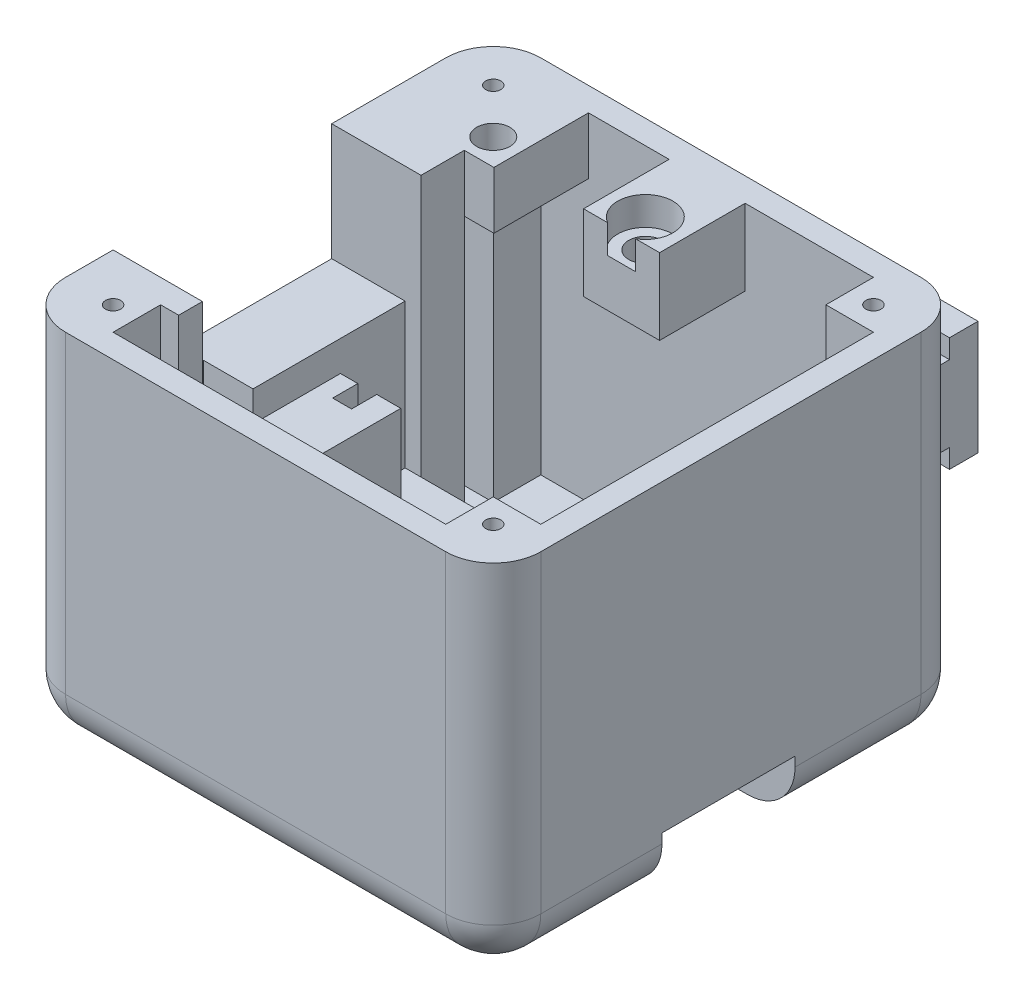
from build123d import *

# Parameters (mm, degrees)
SKETCH1_W                = 50
SKETCH1_H                = 50
BOSS_EXTRUDE1_DEPTH      = 38
SHELL1_T                 = -2.5
BOSS_EXTRUDE2_DEPTH      = 15
SKETCH3_W                = 45
SKETCH3_H                = 16
BOSS_EXTRUDE3_DEPTH      = 8
SKETCH4_W                = 32.5
SKETCH4_H                = 8.5
CUT_EXTRUDE1_DEPTH       = 2.6
SKETCH7_W                = 32.5
SKETCH7_H                = 12.5
CUT_EXTRUDE2_DEPTH       = 3.2
SKETCH9_W                = 8.5
SKETCH9_H                = 32.5
CUT_EXTRUDE3_DEPTH       = 3
CUT_EXTRUDE5_DEPTH       = 3
FILLET1_R                = 5
SKETCH16_R               = 1.9
CUT_EXTRUDE8_DEPTH       = 53.768953941
SKETCH17_W               = 23
SKETCH17_H               = 12
BOSS_EXTRUDE5_DEPTH      = 6
SKETCH18_W               = 3
SKETCH18_H               = 2
CUT_EXTRUDE9_DEPTH       = 57.471231614
CUT_EXTRUDE13_DEPTH      = 2
CUT_EXTRUDE14_DEPTH      = 19
CUT_EXTRUDE10_START      = -19.5
CUT_EXTRUDE10_DEPTH      = 19.5
CUT_EXTRUDE35_START      = -19.5
CUT_EXTRUDE35_DEPTH      = 19.5
FILLET4_R                = 2
CUT_EXTRUDE18_DEPTH      = 13
CUT_EXTRUDE18_DEPTH_BACK = 1
SKETCH26_W               = 6
SKETCH26_H               = 6
SKETCH30_W               = 4.8
SKETCH30_H               = 2.3
CUT_EXTRUDE19_DEPTH      = 59.832389039
SKETCH34_W               = 2
SKETCH34_H               = 3.1
CUT_EXTRUDE23_DEPTH      = 7.3
CUT_EXTRUDE25_START      = -3
CUT_EXTRUDE25_DEPTH      = 3
FILLET8_R                = 2
SKETCH56_W               = 5
SKETCH56_H               = 5
BOSS_EXTRUDE10_DEPTH     = 35.5
CIRPATTERN1_COUNT        = 4
SKETCH62_W               = 6.9
SKETCH62_H               = 2.75
BOSS_EXTRUDE11_DEPTH     = 35.5
SKETCH63_W               = 6.9
SKETCH63_H               = 4.55
BOSS_EXTRUDE12_DEPTH     = 35.5
CUT_EXTRUDE37_REACH      = 72.036
SKETCH64_W               = 23
SKETCH64_H               = 12.3
SKETCH65_W               = 5.223922691
SKETCH65_H               = 16
BOSS_EXTRUDE13_DEPTH     = 15.2
BOSS_EXTRUDE14_DEPTH     = 20
BOSS_EXTRUDE18_REACH     = 59.546
SKETCH68_W               = 2.5
SKETCH68_H               = 26.3
SKETCH69_W               = 6.346077309
SKETCH69_H               = 9.2
BOSS_EXTRUDE20_DEPTH     = 12
SKETCH70_W               = 4.69696766
SKETCH70_H               = 9.2
BOSS_EXTRUDE21_DEPTH     = 12
SKETCH72_W               = 8
SKETCH72_H               = 8
BOSS_EXTRUDE22_DEPTH     = 9
BOSS_EXTRUDE23_DEPTH     = 6
SKETCH76_R               = 1.75
CUT_EXTRUDE43_DEPTH      = 6
SKETCH81_W               = 2
SKETCH81_H               = 3
CUT_EXTRUDE44_DEPTH      = 10
SKETCH82_W               = 3
SKETCH82_H               = 8.5
BOSS_EXTRUDE24_DEPTH     = 0.2
SKETCH83_W               = 8.5
SKETCH83_H               = 4.3
BOSS_EXTRUDE25_DEPTH     = 0.5
SKETCH45_R               = 3.75
CUT_EXTRUDE27_DEPTH      = 20
SKETCH84_W               = 22.5
SKETCH84_H               = 9.2
BOSS_EXTRUDE26_DEPTH     = 2.8
SKETCH85_R               = 1.75
CUT_EXTRUDE45_DEPTH      = 8
SKETCH86_R               = 2.9
CUT_EXTRUDE47_DEPTH      = 3
SKETCH88_W               = 1.990680165
SKETCH88_H               = 3
CUT_EXTRUDE48_DEPTH      = 12
SKETCH89_W               = 17.5
SKETCH89_H               = 2.5
CUT_EXTRUDE50_DEPTH      = 1.45
SKETCH91_W               = 1.234611636
SKETCH91_H               = 9.75
CUT_EXTRUDE52_DEPTH      = 2
CUT_EXTRUDE53_DEPTH      = 1
CUT_EXTRUDE54_DEPTH      = 2
SKETCH94_W               = 2.73303234
SKETCH94_H               = 4.25
CUT_EXTRUDE55_DEPTH      = 4.5
SKETCH95_W               = 5.73303234
SKETCH95_H               = 4.5
CUT_EXTRUDE56_DEPTH      = 0.25


with BuildPart() as part:
    # Sketch1 → Boss-Extrude1 (new body)
    with BuildSketch(Plane(origin=(0, 0, 0), x_dir=(1, 0, 0), z_dir=(0, 1, 0))):
        Rectangle(SKETCH1_W, SKETCH1_H)
    extrude(amount=BOSS_EXTRUDE1_DEPTH)

    # Shell1
    shell1_openings = [part.faces().sort_by_distance(p)[0] for p in [
        (0, 38, 0),
    ]]
    offset(amount=SHELL1_T, openings=shell1_openings, kind=Kind.INTERSECTION)

    # Sketch2 → Boss-Extrude2 (add)
    with BuildSketch(Plane(origin=(0, 2.5, 0), x_dir=(1, 0, 0), z_dir=(0, 1, 0))):
        Polygon((10.3, 8), (22.5, 8), (22.5, 22.5), (10.3, 22.5), (10.3, 13.5), align=None)
    extrude(amount=BOSS_EXTRUDE2_DEPTH)

    # Sketch3 → Boss-Extrude3 (add)
    with BuildSketch(Plane(origin=(0, 2.5, 0), x_dir=(1, 0, 0), z_dir=(0, 1, 0))):
        Rectangle(SKETCH3_W, SKETCH3_H)
    extrude(amount=BOSS_EXTRUDE3_DEPTH)

    # Sketch4 → Cut-Extrude1 (cut)
    with BuildSketch(Plane.XZ):
        with Locations((8.75, 0)):
            Rectangle(SKETCH4_W, SKETCH4_H)
    extrude(amount=-CUT_EXTRUDE1_DEPTH, mode=Mode.SUBTRACT)

    # Sketch7 → Cut-Extrude2 (cut)
    with BuildSketch(Plane(origin=(0, 2.6, 0), x_dir=(-1, 0, 0), z_dir=(0, -1, 0))):
        with Locations((-8.75, 0)):
            Rectangle(SKETCH7_W, SKETCH7_H)
    extrude(amount=-CUT_EXTRUDE2_DEPTH, mode=Mode.SUBTRACT)

    # Sketch9 → Cut-Extrude3 (cut)
    with BuildSketch(Plane(origin=(25, 0, 0), x_dir=(0, 0, -1), z_dir=(1, 0, 0))):
        with Locations((0, 16.25)):
            Rectangle(SKETCH9_W, SKETCH9_H)
    extrude(amount=-CUT_EXTRUDE3_DEPTH, mode=Mode.SUBTRACT)

    # Sketch10 → Cut-Extrude5 (cut)
    with BuildSketch(Plane(origin=(22, 0, 0), x_dir=(0, 0, -1), z_dir=(1, 0, 0))):
        Polygon((-6, 32.5), (-6, 0), (6.25, 0), (6.25, 2.6), (6.25, 32.5), align=None)
    extrude(amount=-CUT_EXTRUDE5_DEPTH, mode=Mode.SUBTRACT)

    # Fillet1
    # the kernel refuses this fillet: 5 mm, written as the material it takes off along each edge
    with BuildSketch(Plane(origin=(-20, 5, 20), x_dir=(-1, 0, 0), z_dir=(0, 0, 1))) as fillet1_piece_1_section:
        Polygon((0, 0), (FILLET1_R, 0), (FILLET1_R, FILLET1_R), (0, FILLET1_R), align=None)
    fillet1_piece_1 = extrude(amount=FILLET1_R, mode=Mode.PRIVATE)
    fillet1_piece_1 = fillet1_piece_1 - Plane(origin=(-20, 5, 20), x_dir=(0.7071067811865475, 0.7071067811865475, 0), z_dir=(0, 0, 1)) * Sphere(FILLET1_R, mode=Mode.PRIVATE)
    add(fillet1_piece_1, mode=Mode.SUBTRACT)
    with BuildSketch(Plane(origin=(20, 5, 20), x_dir=(1, 0, 0), z_dir=(0, 0, 1))) as fillet1_piece_2_section:
        Polygon((0, 0), (FILLET1_R, 0), (FILLET1_R, -FILLET1_R), (0, -FILLET1_R), align=None)
    fillet1_piece_2 = extrude(amount=FILLET1_R, mode=Mode.PRIVATE)
    fillet1_piece_2 = fillet1_piece_2 - Plane(origin=(20, 5, 20), x_dir=(-0.7071067811865475, 0.7071067811865475, 0), z_dir=(0, 0, 1)) * Sphere(FILLET1_R, mode=Mode.PRIVATE)
    add(fillet1_piece_2, mode=Mode.SUBTRACT)
    with BuildSketch(Plane(origin=(20, 5, -20), x_dir=(1, 0, 0), z_dir=(0, 0, -1))) as fillet1_piece_3_section:
        Polygon((0, 0), (FILLET1_R, 0), (FILLET1_R, FILLET1_R), (0, FILLET1_R), align=None)
    fillet1_piece_3 = extrude(amount=FILLET1_R, mode=Mode.PRIVATE)
    fillet1_piece_3 = fillet1_piece_3 - Plane(origin=(20, 5, -20), x_dir=(-0.7071067811865475, 0.7071067811865475, 0), z_dir=(0, 0, -1)) * Sphere(FILLET1_R, mode=Mode.PRIVATE)
    add(fillet1_piece_3, mode=Mode.SUBTRACT)
    with BuildSketch(Plane(origin=(-20, 5, -20), x_dir=(-1, 0, 0), z_dir=(0, 0, -1))) as fillet1_piece_4_section:
        Polygon((0, 0), (FILLET1_R, 0), (FILLET1_R, -FILLET1_R), (0, -FILLET1_R), align=None)
    fillet1_piece_4 = extrude(amount=FILLET1_R, mode=Mode.PRIVATE)
    fillet1_piece_4 = fillet1_piece_4 - Plane(origin=(-20, 5, -20), x_dir=(0.7071067811865475, 0.7071067811865475, 0), z_dir=(0, 0, -1)) * Sphere(FILLET1_R, mode=Mode.PRIVATE)
    add(fillet1_piece_4, mode=Mode.SUBTRACT)
    with BuildSketch(Plane(origin=(-25, 5, 25), x_dir=(0, 0, -1), z_dir=(0, 1, 0)), Plane(origin=(-25, 5, -25), x_dir=(1, 0, 0), z_dir=(0, 1, 0))) as fillet1_piece_5:
        with BuildLine():
            CenterArc((FILLET1_R, -FILLET1_R), FILLET1_R, 90, 90)
            Line((0, -FILLET1_R), (0, 0))
            Line((0, 0), (FILLET1_R, 0))
        make_face()
    extrude(amount=45.5, mode=Mode.SUBTRACT)
    with BuildSketch(Plane(origin=(25, 5, 25), x_dir=(0, 0, -1), z_dir=(0, 1, 0)), Plane(origin=(25, 5, -25), x_dir=(-1, 0, 0), z_dir=(0, 1, 0))) as fillet1_piece_6:
        with BuildLine():
            CenterArc((FILLET1_R, FILLET1_R), FILLET1_R, 180, 90)
            Line((0, FILLET1_R), (0, 0))
            Line((0, 0), (FILLET1_R, 0))
        make_face()
    extrude(amount=45.5, mode=Mode.SUBTRACT)
    with BuildSketch(Plane(origin=(-25, 0, -20), x_dir=(0, 1, 0), z_dir=(0, 0, 1)), Plane(origin=(20, 0, -25), x_dir=(0, 1, 0), z_dir=(-1, 0, 0))) as fillet1_piece_7:
        with BuildLine():
            CenterArc((FILLET1_R, -FILLET1_R), FILLET1_R, 90, 90)
            Line((0, -FILLET1_R), (0, 0))
            Line((0, 0), (FILLET1_R, 0))
        make_face()
    extrude(amount=40, mode=Mode.SUBTRACT)
    with BuildSketch(Plane(origin=(-20, 0, 25), x_dir=(0, 0, -1), z_dir=(1, 0, 0))) as fillet1_piece_8:
        with BuildLine():
            CenterArc((FILLET1_R, FILLET1_R), FILLET1_R, 180, 90)
            Line((0, FILLET1_R), (0, 0))
            Line((0, 0), (FILLET1_R, 0))
        make_face()
    extrude(amount=40, mode=Mode.SUBTRACT)
    with BuildSketch(Plane(origin=(25, 0, 20), x_dir=(0, 1, 0), z_dir=(0, 0, -1)), Plane(origin=(25, 0, 8.25), x_dir=(0, 1, 0), z_dir=(0, 0, -1))) as fillet1_piece_9:
        with BuildLine():
            CenterArc((FILLET1_R, -FILLET1_R), FILLET1_R, 90, 90)
            Line((0, -FILLET1_R), (0, 0))
            Line((0, 0), (FILLET1_R, 0))
        make_face()
    extrude(amount=28.25, mode=Mode.SUBTRACT)

    # Sketch16 → Cut-Extrude8 (cut, through all)
    with BuildSketch(Plane(origin=(0, 0, 1.75), x_dir=(-1, 0, 0), z_dir=(0, 0, -1))):
        with Locations(Location((-15.3, 9.7, 0), (0, 0, 155.09893763))):
            Circle(SKETCH16_R)
    extrude(amount=CUT_EXTRUDE8_DEPTH, mode=Mode.SUBTRACT)

    # Sketch17 → Boss-Extrude5 (add)
    with BuildSketch(Plane(origin=(0, 0, -25), x_dir=(-1, 0, 0), z_dir=(0, 0, -1))):
        with Locations((-8.5, 25)):
            Rectangle(SKETCH17_W, SKETCH17_H)
    extrude(amount=BOSS_EXTRUDE5_DEPTH)

    # Sketch18 → Cut-Extrude9 (cut, through all)
    with BuildSketch(Plane.ZY.offset(3)):
        with Locations((-26.5, 20)):
            Rectangle(SKETCH18_W, SKETCH18_H)
        with Locations((-26.5, 30)):
            Rectangle(SKETCH18_W, SKETCH18_H)
    extrude(amount=-CUT_EXTRUDE9_DEPTH, mode=Mode.SUBTRACT)

    # Sketch21 → Cut-Extrude13 (cut)
    with BuildSketch(Plane(origin=(0, 0, 4.25), x_dir=(-1, 0, 0), z_dir=(0, 0, -1))):
        with BuildLine():
            Line((-15.746666667, 2.6), (-19, 2.6))
            Line((-19, 2.6), (-19, 0))
            Line((-19, 0), (-18, 0))
            ThreePointArc((-18, 0), (-17.358276657, 1.720284214), (-15.746666667, 2.6))
        make_face()
    extrude(amount=-CUT_EXTRUDE13_DEPTH, mode=Mode.SUBTRACT)

    # Sketch22 → Cut-Extrude14 (cut)
    with BuildSketch(Plane(origin=(0, 0, 4.25), x_dir=(-1, 0, 0), z_dir=(0, 0, -1))):
        with BuildLine():
            Line((-15.3, 9.7), (-14.171286845, 3.298749605))
            ThreePointArc((-14.171286845, 3.298749605), (-19.896194078, 5.103805922), (-21.701250395, 10.828713155))
            Line((-21.701250395, 10.828713155), (-15.3, 9.7))
        make_face()
    extrude(amount=CUT_EXTRUDE14_DEPTH, mode=Mode.SUBTRACT)

    # Sketch19 → Cut-Extrude10 (cut)
    with BuildSketch(Plane(origin=(0, 0, -25), x_dir=(-1, 0, 0), z_dir=(0, 0, -1)).offset(CUT_EXTRUDE10_START)):
        with BuildLine():
            ThreePointArc((-16.15049081, 8.000981053), (-16.643502884, 8.356497116), (-16.999018947, 8.84950919))
            Line((-16.999018947, 8.84950919), (-17.600059711, 8.248468426))
            Line((-17.600059711, 8.248468426), (-16.751531574, 7.399940289))
            Line((-16.751531574, 7.399940289), (-16.15049081, 8.000981053))
        make_face()
        with BuildLine():
            ThreePointArc((-14.44950919, 11.399018947), (-13.956497116, 11.043502884), (-13.600981053, 10.55049081))
            Line((-13.600981053, 10.55049081), (-12.999940289, 11.151531574))
            Line((-12.999940289, 11.151531574), (-13.848468426, 12.000059711))
            Line((-13.848468426, 12.000059711), (-14.44950919, 11.399018947))
        make_face()
    extrude(amount=CUT_EXTRUDE10_DEPTH, mode=Mode.SUBTRACT)

    # Sketch55 → Cut-Extrude35 (cut)
    with BuildSketch(Plane(origin=(0, 0, -25), x_dir=(-1, 0, 0), z_dir=(0, 0, -1)).offset(CUT_EXTRUDE35_START)):
        with BuildLine():
            Line((-16.999018947, 8.84950919), (-17.600059711, 8.248468426))
            Line((-17.600059711, 8.248468426), (-16.751531574, 7.399940289))
            Line((-16.751531574, 7.399940289), (-16.15049081, 8.000981053))
            ThreePointArc((-16.15049081, 8.000981053), (-16.643502884, 8.356497116), (-16.999018947, 8.84950919))
        make_face()
        with BuildLine():
            Line((-14.44950919, 11.399018947), (-13.848468426, 12.000059711))
            Line((-13.848468426, 12.000059711), (-12.999940289, 11.151531574))
            Line((-12.999940289, 11.151531574), (-13.576631206, 10.5))
            ThreePointArc((-13.576631206, 10.5), (-13.936824633, 11.023538031), (-14.44950919, 11.399018947))
        make_face()
    extrude(amount=CUT_EXTRUDE35_DEPTH, mode=Mode.SUBTRACT)

    # Fillet4
    fillet4_edges = [part.edges().sort_by_distance(p)[0] for p in [
        (-3, 31, -29.5),
        (-3, 19, -29.5),
        (-3, 25, -31),
    ]]
    fillet(fillet4_edges, radius=FILLET4_R)

    # Sketch26 → Cut-Extrude18 (cut, two sides: drawn at the far end of the back side and taken through both)
    with BuildSketch(Plane(origin=(0, 0, 6.25), x_dir=(-1, 0, 0), z_dir=(0, 0, -1)).offset(-CUT_EXTRUDE18_DEPTH_BACK)):
        with Locations((-22, 3)):
            Rectangle(SKETCH26_W, SKETCH26_H)
    extrude(amount=CUT_EXTRUDE18_DEPTH + CUT_EXTRUDE18_DEPTH_BACK, mode=Mode.SUBTRACT)

    # Sketch30 → Cut-Extrude19 (cut, through all)
    with BuildSketch(Plane(origin=(-7.5, 0, 0), x_dir=(0, 0, -1), z_dir=(1, 0, 0))):
        with Locations((0, 2.6)):
            Rectangle(SKETCH30_W, SKETCH30_H)
    extrude(amount=-CUT_EXTRUDE19_DEPTH, mode=Mode.SUBTRACT)

    # Sketch34 → Cut-Extrude23 (cut)
    with BuildSketch(Plane(origin=(0, 10.5, 0), x_dir=(1, 0, 0), z_dir=(0, 1, 0))):
        with Locations((-14.45, 0)):
            Rectangle(SKETCH34_W, SKETCH34_H)
    extrude(amount=-CUT_EXTRUDE23_DEPTH, mode=Mode.SUBTRACT)

    # Sketch43 → Cut-Extrude25 (cut)
    with BuildSketch(Plane.XY.offset(-4.25).offset(CUT_EXTRUDE25_START)):
        with BuildLine():
            Line((18, 0), (19, 0))
            Line((19, 0), (19, 2.6))
            Line((19, 2.6), (15.746666667, 2.6))
            ThreePointArc((15.746666667, 2.6), (17.358276657, 1.720284214), (18, 0))
        make_face()
    extrude(amount=CUT_EXTRUDE25_DEPTH, mode=Mode.SUBTRACT)

    # Fillet8
    # the kernel refuses this fillet: 2 mm, written as the material it takes off along each edge
    with BuildSketch(Plane(origin=(19, -4.330127019, 6.25), x_dir=(0, 0, 1), z_dir=(0, 1, 0))) as fillet8_piece_1_section:
        with BuildLine():
            CenterArc((2, -1.732050808), FILLET8_R, 120, 60)
            Line((0, -1.732050808), (0, 0))
            Line((0, 0), (1, 0))
        make_face()
    fillet8_piece_1 = extrude(amount=10.130127019, mode=Mode.PRIVATE)
    fillet8_piece_1 = fillet8_piece_1 - Plane(origin=(15.373333333, 0, 6.514485091), x_dir=(1, 0, 0), z_dir=(0, 0, -1)) * Cylinder(2.626666667, 28, mode=Mode.PRIVATE)
    add(fillet8_piece_1, mode=Mode.SUBTRACT)

    # Sketch56 → Boss-Extrude10 (add)
    with BuildSketch(Plane(origin=(0, 2.5, 0), x_dir=(1, 0, 0), z_dir=(0, 1, 0))):
        with Locations((-20, -20)):
            Rectangle(SKETCH56_W, SKETCH56_H)
    boss_extrude10 = extrude(amount=BOSS_EXTRUDE10_DEPTH)

    # Sketch59 → M2 Tapped Hole3 (revolve, cut)
    with BuildSketch(Plane(origin=(-20, 38, 20), x_dir=(0, 0, 1), z_dir=(1, 0, 0))):
        Polygon((0, 0), (0, 5.480688495), (0.8, 5), (0.8, 0), align=None)
    m2_tapped_hole3 = revolve(axis=Axis((-20, 44.35, 20), (0, -1, 0)), mode=Mode.SUBTRACT)

    # CirPattern1: Boss-Extrude10, M2 Tapped Hole3 ×4 about axis
    cirpattern1_axis = Axis((0, 0, 0), (0, 1, 0))
    add([boss_extrude10.rotate(cirpattern1_axis, i * 360 / CIRPATTERN1_COUNT) for i in range(1, CIRPATTERN1_COUNT)])
    add([m2_tapped_hole3.rotate(cirpattern1_axis, i * 360 / CIRPATTERN1_COUNT) for i in range(1, CIRPATTERN1_COUNT)], mode=Mode.SUBTRACT)

    # Sketch62 → Boss-Extrude11 (add)
    with BuildSketch(Plane(origin=(0, 2.5, 0), x_dir=(1, 0, 0), z_dir=(0, 1, 0))):
        with Locations((-19.05, -16.125)):
            Rectangle(SKETCH62_W, SKETCH62_H)
    extrude(amount=BOSS_EXTRUDE11_DEPTH)

    # Sketch63 → Boss-Extrude12 (add)
    with BuildSketch(Plane(origin=(0, 2.5, 0), x_dir=(1, 0, 0), z_dir=(0, 1, 0))):
        with Locations((-19.05, 10.275)):
            Rectangle(SKETCH63_W, SKETCH63_H)
    extrude(amount=BOSS_EXTRUDE12_DEPTH)

    # Sketch64 → Cut-Extrude37 (cut, up to next)
    with BuildSketch(Plane.ZY.offset(25), mode=Mode.PRIVATE) as cut_extrude37_sk1:
        with Locations((3.5, 31.85)):
            Rectangle(SKETCH64_W, SKETCH64_H)
    cut_extrude37_tool1 = extrude(cut_extrude37_sk1.sketch, amount=-CUT_EXTRUDE37_REACH, mode=Mode.PRIVATE) & part.part
    add(cut_extrude37_tool1.solids().sort_by_distance((-25, 31.85, 3.5))[0], mode=Mode.SUBTRACT)

    # Sketch65 → Boss-Extrude13 (add)
    with BuildSketch(Plane(origin=(0, 10.5, 0), x_dir=(1, 0, 0), z_dir=(0, 1, 0))):
        with Locations((-19.888038655, 0)):
            Rectangle(SKETCH65_W, SKETCH65_H)
    extrude(amount=BOSS_EXTRUDE13_DEPTH)

    # Sketch66 → Boss-Extrude14 (add)
    with BuildSketch(Plane(origin=(0, 2.5, 0), x_dir=(1, 0, 0), z_dir=(0, 1, 0))):
        Polygon((-10.93, -8), (-12.93, -8), (-12.93, -16.5), (13.57, -16.5), (13.57, -8), (11.57, -8), (11.57, -14.5), (-10.93, -14.5), align=None)
    extrude(amount=BOSS_EXTRUDE14_DEPTH)

    # Sketch68 → Boss-Extrude18 (add, up to next)
    with BuildSketch(Plane(origin=(0, 0, 4.25), x_dir=(-1, 0, 0), z_dir=(0, 0, -1)), mode=Mode.PRIVATE) as boss_extrude18_sk1:
        with Locations((-23.75, 19.35)):
            Rectangle(SKETCH68_W, SKETCH68_H)
    boss_extrude18_tool1 = extrude(boss_extrude18_sk1.sketch, amount=BOSS_EXTRUDE18_REACH, mode=Mode.PRIVATE) - part.part
    add(boss_extrude18_tool1.solids().sort_by_distance((23.75, 19.35, 4.25))[0])

    # Sketch69 → Boss-Extrude20 (add)
    with BuildSketch(Plane(origin=(0, 10.5, 0), x_dir=(1, 0, 0), z_dir=(0, 1, 0))):
        with Locations((-14.103038655, -3.4)):
            Rectangle(SKETCH69_W, SKETCH69_H)
    extrude(amount=BOSS_EXTRUDE20_DEPTH)

    # Sketch70 → Boss-Extrude21 (add)
    with BuildSketch(Plane(origin=(0, 10.5, 0), x_dir=(1, 0, 0), z_dir=(0, 1, 0))):
        with Locations((13.91848383, -3.4)):
            Rectangle(SKETCH70_W, SKETCH70_H)
    extrude(amount=BOSS_EXTRUDE21_DEPTH)

    # Sketch72 → Boss-Extrude22 (add)
    with BuildSketch(Plane.XY.offset(-22.5)):
        with Locations((0, 34)):
            Rectangle(SKETCH72_W, SKETCH72_H)
    extrude(amount=BOSS_EXTRUDE22_DEPTH)

    # Sketch75 → Boss-Extrude23 (add)
    with BuildSketch(Plane(origin=(0, 38, 0), x_dir=(1, 0, 0), z_dir=(0, 1, 0))):
        Polygon((-15.6, 12.55), (-12.482059463, 12.55), (-12.482059463, 22.5), (-17.5, 22.5), (-17.5, 17.5), (-22.5, 17.5), (-22.5, 12.55), align=None)
    extrude(amount=-BOSS_EXTRUDE23_DEPTH)

    # Sketch76 → Cut-Extrude43 (cut)
    with BuildSketch(Plane(origin=(0, 38, 0), x_dir=(1, 0, 0), z_dir=(0, 1, 0))):
        with Locations(Location((-15.3, 15.3, 0), (0, 0, 270))):
            Circle(SKETCH76_R)
    extrude(amount=-CUT_EXTRUDE43_DEPTH, mode=Mode.SUBTRACT)

    # Sketch81 → Cut-Extrude44 (cut)
    with BuildSketch(Plane(origin=(0, 22.5, 0), x_dir=(1, 0, 0), z_dir=(0, 1, 0))):
        with Locations((-11.93, -9.5)):
            Rectangle(SKETCH81_W, SKETCH81_H)
    extrude(amount=-CUT_EXTRUDE44_DEPTH, mode=Mode.SUBTRACT)

    # Sketch82 → Boss-Extrude24 (add)
    with BuildSketch(Plane.XZ.offset(-6.2)):
        with Locations((23.5, 0)):
            Rectangle(SKETCH82_W, SKETCH82_H)
    extrude(amount=BOSS_EXTRUDE24_DEPTH)

    # Sketch83 → Boss-Extrude25 (add)
    with BuildSketch(Plane.ZY.offset(-22.5)):
        with Locations((0, 8.35)):
            Rectangle(SKETCH83_W, SKETCH83_H)
    extrude(amount=BOSS_EXTRUDE25_DEPTH)

    # Sketch45 → Cut-Extrude27 (cut)
    with BuildSketch(Plane(origin=(0, 0, 1.75), x_dir=(-1, 0, 0), z_dir=(0, 0, -1))):
        with Locations(Location((-15.3, 9.7, 0), (0, 0, 170))):
            Circle(SKETCH45_R)
    extrude(amount=CUT_EXTRUDE27_DEPTH, mode=Mode.SUBTRACT)

    # Sketch84 → Boss-Extrude26 (add)
    with BuildSketch(Plane(origin=(0, 10.5, 0), x_dir=(1, 0, 0), z_dir=(0, 1, 0))):
        with Locations((0.32, -3.4)):
            Rectangle(SKETCH84_W, SKETCH84_H)
    extrude(amount=BOSS_EXTRUDE26_DEPTH)

    # Sketch85 → Cut-Extrude45 (cut)
    with BuildSketch(Plane(origin=(0, 38, 0), x_dir=(1, 0, 0), z_dir=(0, 1, 0))):
        with Locations(Location((0, 16, 0), (0, 0, 270))):
            Circle(SKETCH85_R)
    extrude(amount=-CUT_EXTRUDE45_DEPTH, mode=Mode.SUBTRACT)

    # Sketch86 → Cut-Extrude47 (cut)
    with BuildSketch(Plane(origin=(0, 38, 0), x_dir=(1, 0, 0), z_dir=(0, 1, 0))):
        with Locations((0, 16)):
            Circle(SKETCH86_R)
    extrude(amount=-CUT_EXTRUDE47_DEPTH, mode=Mode.SUBTRACT)

    # Sketch88 → Cut-Extrude48 (cut)
    with BuildSketch(Plane(origin=(0, 22.5, 0), x_dir=(1, 0, 0), z_dir=(0, 1, 0))):
        with Locations((-14.454659918, 0.05)):
            Rectangle(SKETCH88_W, SKETCH88_H)
    extrude(amount=-CUT_EXTRUDE48_DEPTH, mode=Mode.SUBTRACT)

    # Sketch89 → Cut-Extrude50 (cut)
    with BuildSketch(Plane.XZ):
        with Locations((-16.25, 0)):
            Rectangle(SKETCH89_W, SKETCH89_H)
    extrude(amount=-CUT_EXTRUDE50_DEPTH, mode=Mode.SUBTRACT)

    # Sketch91 → Cut-Extrude52 (cut)
    with BuildSketch(Plane(origin=(-1.197446244, 6.791055114, 0), x_dir=(0.984807753012208, 0.17364817766693094, 0), z_dir=(0.17364817766693094, -0.984807753012208, 0))):
        with Locations((20.741656513, -3.125)):
            Rectangle(SKETCH91_W, SKETCH91_H)
    extrude(amount=-CUT_EXTRUDE52_DEPTH, mode=Mode.SUBTRACT)

    # Sketch92 → Cut-Extrude53 (cut)
    with BuildSketch(Plane.XY.offset(-6.25)):
        Polygon((14.171286845, 3.298749605), (14.171286845, 2.6), (19, 2.6), (19, 4.355844314), align=None)
        Polygon((20.644155686, 6), (22, 6), (22, 10.5), (21.750581369, 10.5), align=None)
    extrude(amount=-CUT_EXTRUDE53_DEPTH, mode=Mode.SUBTRACT)

    # Sketch93 → Cut-Extrude54 (cut)
    with BuildSketch(Plane(origin=(0, 0, 4.25), x_dir=(-1, 0, 0), z_dir=(0, 0, -1))):
        Polygon((-19, 10.352409829), (-15.3, 9.7), (-14.612324775, 5.8), (-19, 5.8), align=None)
    extrude(amount=-CUT_EXTRUDE54_DEPTH, mode=Mode.SUBTRACT)

    # Sketch94 → Cut-Extrude55 (cut)
    with BuildSketch(Plane(origin=(0, 10.5, 0), x_dir=(1, 0, 0), z_dir=(0, 1, 0))):
        with Locations((17.63348383, -3.875)):
            Rectangle(SKETCH94_W, SKETCH94_H)
    extrude(amount=-CUT_EXTRUDE55_DEPTH, mode=Mode.SUBTRACT)

    # Sketch95 → Cut-Extrude56 (cut)
    with BuildSketch(Plane(origin=(0, 0, 6), x_dir=(-1, 0, 0), z_dir=(0, 0, -1))):
        with Locations((-19.13348383, 8.25)):
            Rectangle(SKETCH95_W, SKETCH95_H)
    extrude(amount=-CUT_EXTRUDE56_DEPTH, mode=Mode.SUBTRACT)


solid = part.part
